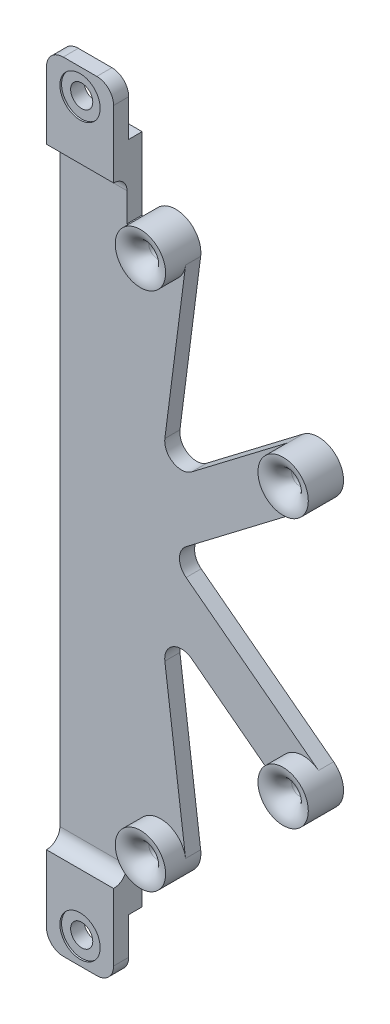
from build123d import *

# Parameters (mm, degrees)
SKETCH_1_W                   = 20
SKETCH_1_H                   = 232
EXTRUDE_1_DEPTH              = 4.5
EXTRUDE_3_DEPTH              = 4.5
FILLET_2_R                   = 4.999999999999999
HOLE_WIZARD_M6_1_D           = 5
FILLET_4_R                   = 4.999999999999999
EXTRUDE_START                = 4
EXTRUDE_4_DEPTH              = 4
SKETCH_9_W                   = 319.0213755361433
SKETCH_9_H                   = 251.11270465686212
CUT_EXTRUDE_1_DEPTH          = 4
FILLET_5_R                   = 4
HOLE_WIZARD_M6_2_D           = 6.6
HOLE_WIZARD_M6_2_CBORE_D     = 12
HOLE_WIZARD_M6_2_CBORE_DEPTH = 0.5
EXTRUDE_START_2              = 6
SKETCH_13_R                  = 2.4999999999999987
SKETCH_13_R_2                = 2.499999999999995
EXTRUDE_5_DEPTH              = 6
FILLET_6_R                   = 5


# Some blends are built 0.0001 mm under size
with BuildPart() as part:
    # 草图1 → 凸台-拉伸1 (new body)
    with BuildSketch(Plane.XY):
        Rectangle(SKETCH_1_W, SKETCH_1_H)
    extrude(amount=EXTRUDE_1_DEPTH)

    # 草图4 → 凸台-拉伸3 (add)
    with BuildSketch(Plane.XY.offset(4.5)):
        with BuildLine():
            Line((67.04532411447143, -34.03426209975627), (22.3753551085413, -8.9e-16))
            Line((22.375355108541303, -2.66e-15), (67.04532411447141, 34.0342620997563))
            ThreePointArc((67.04532411447141, 34.03426209975629), (68.46573790024371, 44.54532411447144), (57.954675885528566, 45.96573790024377))
            Line((57.954675885528566, 45.96573790024377), (19.735945661830147, 16.846705348854464))
            Line((19.73594566183015, 16.846705348854464), (27.438333999755184, 76.54021496777352))
            ThreePointArc((27.438333999755184, 76.54021496777352), (20.959785032226467, 84.9383339997552), (12.561666000244795, 78.45978503222648))
            Line((12.561666000244797, 78.45978503222648), (10.000000000000002, 78.45978503222645))
            Line((10.000000000000002, 78.45978503222645), (9.999999999999897, 58.60687353032759))
            Line((9.999999999999785, 58.606873530327604), (2.561666000244813, 0.9597850322264776))
            ThreePointArc((2.5616660002448137, 0.9597850322264744), (2.5000000000000036, -1.321e-14), (2.561666000244818, -0.9597850322265004))
            Line((2.561666000244811, -0.959785032226501), (9.999999999999945, -58.606873530328755))
            Line((9.999999999999973, -58.606873530328755), (10.000000000000002, -78.45978503222648))
            Line((10.000000000000002, -78.45978503222648), (12.561666000244813, -78.45978503222648))
            ThreePointArc((12.561666000244813, -78.45978503222648), (20.95978503222648, -84.9383339997552), (27.43833399975519, -76.54021496777352))
            Line((27.438333999755194, -76.54021496777352), (19.735945661830147, -16.846705348854485))
            Line((19.735945661830144, -16.84670534885448), (57.95467588552857, -45.96573790024377))
            ThreePointArc((57.95467588552857, -45.96573790024377), (68.46573790024374, -44.54532411447145), (67.04532411447143, -34.034262099756276))
        make_face()
    extrude(amount=-EXTRUDE_3_DEPTH)

    # 圆角2
    fillet_2_edges = [part.edges().sort_by_distance(p)[0] for p in [
        (19.735945661830144, -16.846705348854485, 2.25),
        (22.3753551085413, -1.78e-15, 2.25),
        (19.73594566183015, 16.846705348854464, 2.25),
    ]]
    fillet(fillet_2_edges, radius=FILLET_2_R)

    # Hole Wizard M6 _1 (through all)
    with Locations(Plane.XY.offset(4.5)):
        with Locations((20, 77.5), (62.5, 40), (20, -77.5), (62.5, -40)):
            Hole(HOLE_WIZARD_M6_1_D / 2)

    # 圆角4
    fillet_4_edges = [part.edges().sort_by_distance(p)[0] for p in [
        (10.000000000000002, -116.00000000000001, 2.25),
        (-9.999999999999998, -116.00000000000001, 2.25),
        (-9.999999999999998, 115.99999999999999, 2.25),
        (10.000000000000002, 115.99999999999999, 2.25),
    ]]
    fillet(fillet_4_edges, radius=FILLET_4_R)

    # 草图8 → 凸台-拉伸4 (add)
    with BuildSketch(Plane.XY.offset(4.5).offset(EXTRUDE_START)):
        with BuildLine():
            Line((10, -91), (-10, -91))
            Line((-9.999999999999998, -91.00000000000001), (-9.999999999999998, -111.00000000000001))
            ThreePointArc((-10, -111.00000000000001), (-8.535533905932738, -114.53553390593275), (-5, -116.00000000000001))
            Line((-5, -116.00000000000001), (5.0000000000000036, -116.00000000000001))
            ThreePointArc((5.000000000000003, -116.00000000000001), (8.535533905932741, -114.53553390593275), (10.000000000000004, -111.00000000000001))
            Line((10.000000000000005, -111.00000000000001), (10.000000000000004, -91))
        make_face()
        with BuildLine():
            Line((-9.999999999999998, 110.99999999999993), (-9.999999999999998, 91))
            Line((-10, 91), (10, 91))
            Line((10.000000000000002, 91), (10.000000000000002, 110.99999999999993))
            ThreePointArc((10, 110.99999999999993), (8.535533905932763, 114.53553390593271), (5.000000000000003, 115.99999999999999))
            Line((5.000000000000003, 115.99999999999999), (-4.999999999999999, 115.99999999999999))
            ThreePointArc((-4.999999999999999, 115.99999999999999), (-8.535533905932759, 114.53553390593271), (-9.999999999999996, 110.99999999999993))
        make_face()
    extrude(amount=-EXTRUDE_4_DEPTH)

    # 草图9 → 切除-拉伸1 (cut)
    with BuildSketch(Plane(origin=(0, 0, 0), x_dir=(-1, 0, 0), z_dir=(0, 0, -1))):
        Rectangle(SKETCH_9_W, SKETCH_9_H)
        Polygon((-82.97210234114478, 100), (82.97210234114469, 100), (82.97210234114472, -100), (-82.97210234114475, -100), align=None, mode=Mode.SUBTRACT)
    extrude(amount=-CUT_EXTRUDE_1_DEPTH, mode=Mode.SUBTRACT)

    # 圆角5
    fillet_5_edges = [part.edges().sort_by_distance(p)[0] for p in [
        (0, -91, 4.5),
        (0, 91, 4.5),
    ]]
    fillet(fillet_5_edges, radius=FILLET_5_R - 0.0001)  # a hair under: the kernel refuses the full size

    # M6 六角头螺栓的柱形沉头孔2 (through all)
    with Locations(Plane.XY.offset(8.5)):
        with Locations((0, 108.25), (0, -108.25)):
            CounterBoreHole(HOLE_WIZARD_M6_2_D / 2, HOLE_WIZARD_M6_2_CBORE_D / 2, HOLE_WIZARD_M6_2_CBORE_DEPTH)

    # 草图13 → 凸台-拉伸5 (add)
    # profile 1 of 4: a face of its own
    with BuildSketch(Plane.XY.offset(4.5).offset(EXTRUDE_START_2)):
        with BuildLine():
            ThreePointArc((27.438333999755173, 76.54021496777352), (27.484567622720885, 77.01911799688693), (27.499999999999986, 77.5))
            ThreePointArc((27.499999999999986, 77.5), (20.480882003113063, 84.9845676227209), (12.561666000244797, 78.45978503222648))
            ThreePointArc((12.561666000244797, 78.45978503222648), (19.040214967773508, 70.06166600024481), (27.438333999755173, 76.54021496777352))
        make_face()
        with Locations((19.999999999999986, 77.5)):
            Circle(SKETCH_13_R, mode=Mode.SUBTRACT)
    # profile 2 of 4: a face of its own
    with BuildSketch(Plane.XY.offset(4.5).offset(EXTRUDE_START_2)):
        with BuildLine():
            ThreePointArc((70, 40.00000000000002), (65.82866858829955, 46.72086046792137), (57.954675885528566, 45.96573790024377))
            ThreePointArc((57.954675885528566, 45.96573790024377), (56.53426209975625, 35.454675885528594), (67.04532411447143, 34.034262099756276))
            ThreePointArc((67.04532411447143, 34.034262099756276), (69.22086046792134, 36.671331411700464), (70, 40.00000000000002))
        make_face()
        with Locations((62.49999999999999, 40.00000000000002)):
            Circle(SKETCH_13_R_2, mode=Mode.SUBTRACT)
    # profile 3 of 4: a face of its own
    with BuildSketch(Plane.XY.offset(4.5).offset(EXTRUDE_START_2)):
        with BuildLine():
            ThreePointArc((69.99999999999999, -40.00000000000002), (69.22086046792133, -36.67133141170047), (67.04532411447141, -34.03426209975629))
            ThreePointArc((67.04532411447141, -34.03426209975629), (56.53426209975626, -35.4546758855286), (57.95467588552858, -45.96573790024376))
            ThreePointArc((57.95467588552858, -45.96573790024376), (65.82866858829955, -46.720860467921355), (69.99999999999999, -40.00000000000002))
        make_face()
        with Locations((62.49999999999999, -40.00000000000002)):
            Circle(SKETCH_13_R_2, mode=Mode.SUBTRACT)
    # profile 4 of 4: a face of its own
    with BuildSketch(Plane.XY.offset(4.5).offset(EXTRUDE_START_2)):
        with BuildLine():
            ThreePointArc((27.438333999755177, -76.54021496777352), (19.040214967773533, -70.06166600024483), (12.561666000244838, -78.45978503222648))
            ThreePointArc((12.561666000244838, -78.45978503222648), (20.48088200311308, -84.98456762272087), (27.499999999999986, -77.5))
            ThreePointArc((27.499999999999986, -77.5), (27.484567622720885, -77.01911799688692), (27.438333999755177, -76.54021496777352))
        make_face()
        with Locations((20.000000000000007, -77.5)):
            Circle(SKETCH_13_R, mode=Mode.SUBTRACT)
    extrude(amount=-EXTRUDE_5_DEPTH)

    # 圆角6
    # the kernel refuses this fillet: 5 mm, written as the material it takes off along each edge
    with BuildSketch(Plane(origin=(19.999999999999986, 77.5, 10.5), x_dir=(1, 0, 0), z_dir=(0, -1, 0))) as fillet_6_piece_1:
        with BuildLine():
            CenterArc((2.5 + FILLET_6_R, -FILLET_6_R), FILLET_6_R, 90.00000000000017, 89.99999999999983)
            Line((2.5 + FILLET_6_R, 0), (2.5, 0))
            Line((2.5, 0), (2.500000000000014, -FILLET_6_R))
        make_face()
    revolve(axis=Axis((19.999999999999986, 77.5, 10.5), (0, 0, 1)), mode=Mode.SUBTRACT)
    with BuildSketch(Plane(origin=(62.49999999999999, 40.00000000000002, 10.5), x_dir=(1, 0, 0), z_dir=(0, -1, 0))) as fillet_6_piece_2:
        with BuildLine():
            CenterArc((2.499999999999993 + FILLET_6_R, -FILLET_6_R), FILLET_6_R, 90.00000000000017, 89.99999999999983)
            Line((2.499999999999993 + FILLET_6_R, 0), (2.499999999999993, 0))
            Line((2.499999999999993, 0), (2.500000000000007, -FILLET_6_R))
        make_face()
    revolve(axis=Axis((62.49999999999999, 40.00000000000002, 10.5), (0, 0, 1)), mode=Mode.SUBTRACT)
    with BuildSketch(Plane(origin=(62.49999999999999, -40.00000000000002, 10.5), x_dir=(1, 0, 0), z_dir=(0, -1, 0))) as fillet_6_piece_3:
        with BuildLine():
            CenterArc((2.499999999999993 + FILLET_6_R, -FILLET_6_R), FILLET_6_R, 90.00000000000017, 89.99999999999983)
            Line((2.499999999999993 + FILLET_6_R, 0), (2.499999999999993, 0))
            Line((2.499999999999993, 0), (2.500000000000007, -FILLET_6_R))
        make_face()
    revolve(axis=Axis((62.49999999999999, -40.00000000000002, 10.5), (0, 0, 1)), mode=Mode.SUBTRACT)
    with BuildSketch(Plane(origin=(20.000000000000007, -77.5, 10.5), x_dir=(1, 0, 0), z_dir=(0, -1, 0))) as fillet_6_piece_4:
        with BuildLine():
            CenterArc((2.5 + FILLET_6_R, -FILLET_6_R), FILLET_6_R, 89.99999999999993, 90.00000000000006)
            Line((2.5 + FILLET_6_R, 0), (2.5, 0))
            Line((2.5, 0), (2.499999999999993, -FILLET_6_R))
        make_face()
    revolve(axis=Axis((20.000000000000007, -77.5, 10.5), (0, 0, 1)), mode=Mode.SUBTRACT)


solid = part.part
